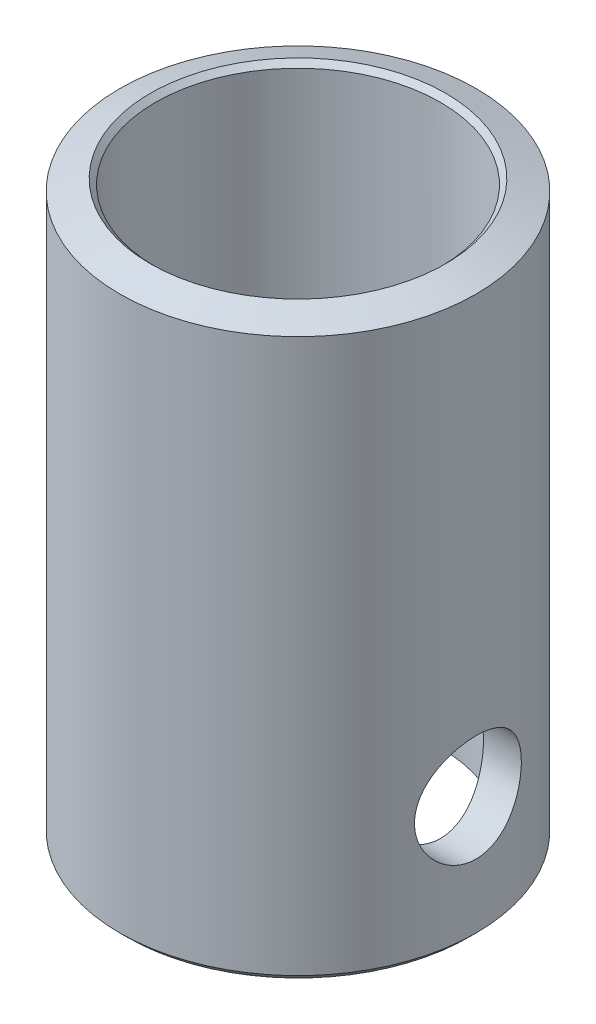
from build123d import *

# Parameters (mm, degrees)
SKETCH1_R               = 5
SKETCH1_R_2             = 4
BOSS_EXTRUDE1_DEPTH     = 16.1
CHAMFER1_SIZE           = 0.2
CHAMFER2_SIZE           = 0.363970234
CHAMFER2_SIZE_2         = 1
CUT_EXTRUDE1_REACH      = 21.557
CUT_EXTRUDE1_END_RADIUS = 4
SKETCH2_R               = 1.5
CIRPATTERN1_COUNT       = 2
CIRPATTERN1_ANGLE       = 90


with BuildPart() as part:
    # Sketch1 → Boss-Extrude1 (new body)
    with BuildSketch(Plane(origin=(0, 0, 0), x_dir=(1, 0, 0), z_dir=(0, 1, 0))):
        with Locations(Location((0, 0, 0), (0, 0, 270))):
            Circle(SKETCH1_R)
        with Locations(Location((0, 0, 0), (0, 0, 270))):
            Circle(SKETCH1_R_2, mode=Mode.SUBTRACT)
    extrude(amount=BOSS_EXTRUDE1_DEPTH)

    # Chamfer1
    chamfer1_edges = [part.edges().sort_by_distance(p)[0] for p in [
        (0, 0, -5),
        (0, 0, -4),
        (0, 16.1, -4),
    ]]
    chamfer(chamfer1_edges, length=CHAMFER1_SIZE)

    # Chamfer2
    # the kernel refuses this chamfer: 1, 0.363970234 mm, written as the material it takes off along each edge
    with BuildSketch(Plane(origin=(0, 16.1, 0), x_dir=(0, 0, 1), z_dir=(-1, 0, 0))) as chamfer2_piece_1:
        Polygon((5, -CHAMFER2_SIZE), (5 - CHAMFER2_SIZE_2, 0), (5, 0), align=None)
    revolve(axis=Axis((0, 16.1, 0), (0, 1, 0)), mode=Mode.SUBTRACT)

    # Cut-Extrude1: up to this cylinder (the profile starts outside it)
    cut_extrude1_end = Plane(origin=(0, 3.5, 0), z_dir=(0, -1, 0)) * Cylinder(CUT_EXTRUDE1_END_RADIUS, 52.114, mode=Mode.PRIVATE)
    # Sketch2 → Cut-Extrude1 (cut, up to the surface)
    with BuildSketch(Plane(origin=(0, 0, -5), x_dir=(-1, 0, 0), z_dir=(0, 0, -1)), mode=Mode.PRIVATE) as cut_extrude1_sk1:
        with Locations((0, 3.5)):
            Circle(SKETCH2_R)
    cut_extrude1_tool1 = extrude(cut_extrude1_sk1.sketch, amount=-CUT_EXTRUDE1_REACH, mode=Mode.PRIVATE) - cut_extrude1_end
    cut_extrude1 = cut_extrude1_tool1.solids().sort_by_distance((0, 3.5, -5))[0]
    add(cut_extrude1, mode=Mode.SUBTRACT)

    # CirPattern1: Cut-Extrude1 ×2 about axis
    cirpattern1_axis = Axis((0, 15.9, 0), (0, -1, 0))
    for i in range(1, CIRPATTERN1_COUNT):
        add(cut_extrude1.rotate(cirpattern1_axis, i * CIRPATTERN1_ANGLE / (CIRPATTERN1_COUNT - 1)), mode=Mode.SUBTRACT)


solid = part.part
